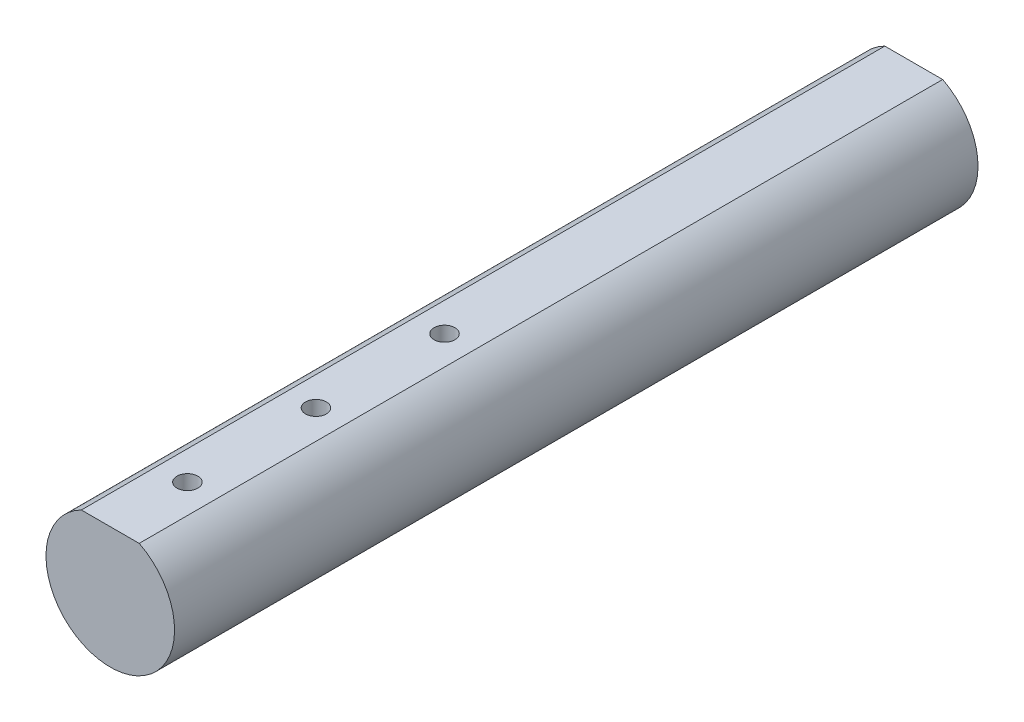
from build123d import *

# Parameters (mm, degrees)
SKETCH1_R           = 10
BOSS_EXTRUDE1_DEPTH = 62.5
SKETCH2_W           = 9
SKETCH2_H           = 5
CUT_EXTRUDE1_DEPTH  = 126.797456254
SKETCH3_R           = 1.625
CUT_EXTRUDE2_DEPTH  = 67.065162612
CUT_EXTRUDE3_START  = -8
SKETCH4_R           = 4
CUT_EXTRUDE3_DEPTH  = 150


with BuildPart() as part:
    # Sketch1 → Boss-Extrude1 (new, symmetric)
    with BuildSketch(Plane.XY):
        Circle(SKETCH1_R)
    extrude(amount=BOSS_EXTRUDE1_DEPTH, both=True)

    # Sketch2 → Cut-Extrude1 (cut, through all)
    with BuildSketch(Plane.XY.offset(62.5)):
        with Locations((0, 11.43028555)):
            Rectangle(SKETCH2_W, SKETCH2_H)
    extrude(amount=-CUT_EXTRUDE1_DEPTH, mode=Mode.SUBTRACT)

    # Sketch3 → Cut-Extrude2 (cut, through all)
    with BuildSketch(Plane(origin=(0, 8.93028555, 0), x_dir=(1, 0, 0), z_dir=(0, 1, 0))):
        with Locations((0, -50.5)):
            Circle(SKETCH3_R)
        with Locations((0, -30.5)):
            Circle(SKETCH3_R)
        with Locations((0, -10.5)):
            Circle(SKETCH3_R)
    extrude(amount=-CUT_EXTRUDE2_DEPTH, mode=Mode.SUBTRACT)

    # Sketch4 → Cut-Extrude3 (cut)
    with BuildSketch(Plane(origin=(0, 8.93028555, 0), x_dir=(1, 0, 0), z_dir=(0, 1, 0)).offset(CUT_EXTRUDE3_START)):
        with Locations((0, -10.5)):
            Circle(SKETCH4_R)
        with Locations((0, -30.5)):
            Circle(SKETCH4_R)
        with Locations((0, -50.5)):
            Circle(SKETCH4_R)
    extrude(amount=-CUT_EXTRUDE3_DEPTH, mode=Mode.SUBTRACT)


solid = part.part
